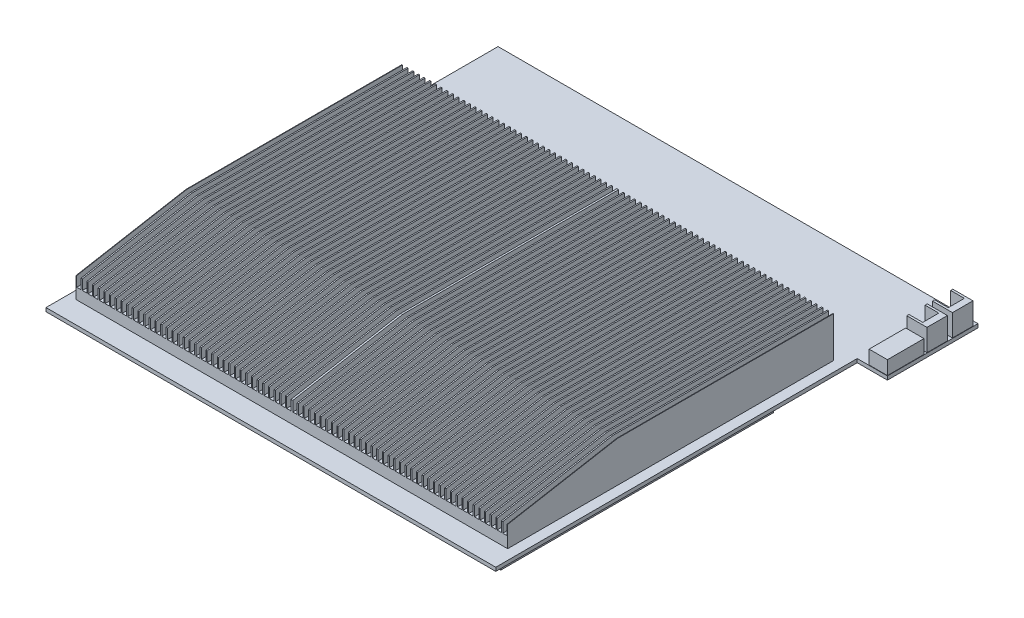
from build123d import *

# Parameters (mm, degrees)
BOSS_EXTRUDE1_DEPTH   = 2
SKETCH2_W             = 235.75
SKETCH2_H             = 178
BOSS_EXTRUDE2_DEPTH   = 22.2
CUT_EXTRUDE1_DEPTH    = 235.75
SKETCH5_W             = 27.3
SKETCH5_H             = 30.25
BOSS_EXTRUDE4_DEPTH   = 12.75
SKETCH6_W             = 2.4
SKETCH6_H             = 16.2
CUT_EXTRUDE2_DEPTH    = 325.747136246
SKETCH7_W             = 2.4
SKETCH7_H             = 10.810120739
CUT_EXTRUDE3_DEPTH    = 352.142086626
SKETCH8_W             = 10
SKETCH8_H             = 20
BOSS_EXTRUDE5_DEPTH   = 7.5
BOSS_EXTRUDE6_DEPTH   = 12
BOSS_EXTRUDE6_2_DEPTH = 12


with BuildPart() as part:
    # Sketch1 → Boss-Extrude1 (new body)
    with BuildSketch(Plane(origin=(0, 0, 0), x_dir=(1, 0, 0), z_dir=(0, 1, 0))):
        Polygon((0, 0), (0, 247), (262.25, 247), (262.25, 197.5), (245.75, 197.5), (245.75, 0), align=None)
    extrude(amount=BOSS_EXTRUDE1_DEPTH)

    # Sketch2 → Boss-Extrude2 (add)
    with BuildSketch(Plane(origin=(0, 2, 0), x_dir=(1, 0, 0), z_dir=(0, 1, 0))):
        with Locations((122.375, 101)):
            Rectangle(SKETCH2_W, SKETCH2_H)
    extrude(amount=BOSS_EXTRUDE2_DEPTH)

    # Sketch3 → Cut-Extrude1 (cut)
    with BuildSketch(Plane(origin=(240.25, 0, 0), x_dir=(0, 0, -1), z_dir=(1, 0, 0))):
        Polygon((12, 13.5), (72, 24.2), (12, 24.2), align=None)
    extrude(amount=-CUT_EXTRUDE1_DEPTH, mode=Mode.SUBTRACT)

    # Sketch5 → Boss-Extrude4 (add)
    with BuildSketch(Plane.XZ):
        Polygon((7.969075183, -163.75), (7.969075183, -14.75), (233.75849879, -14.75), (233.75849879, -163.75), (174.25849879, -163.75), (174.25849879, -196.5), (67.469075183, -196.5), (67.469075183, -163.75), align=None)
        with Locations((136.200813534, -226.375)):
            Rectangle(SKETCH5_W, SKETCH5_H)
    extrude(amount=BOSS_EXTRUDE4_DEPTH)

    # Sketch6 → Cut-Extrude2 (cut, through all)
    with BuildSketch(Plane(origin=(0, 0, -190), x_dir=(-1, 0, 0), z_dir=(0, 0, -1))):
        with Locations((-124.075, 16.1)):
            Rectangle(SKETCH6_W, SKETCH6_H)
        with Locations((-120.675, 16.1)):
            Rectangle(SKETCH6_W, SKETCH6_H)
        with Locations((-127.175, 16.1)):
            Rectangle(SKETCH6_W, SKETCH6_H)
        with Locations((-130.275, 16.1)):
            Rectangle(SKETCH6_W, SKETCH6_H)
        with Locations((-133.375, 16.1)):
            Rectangle(SKETCH6_W, SKETCH6_H)
        with Locations((-136.475, 16.1)):
            Rectangle(SKETCH6_W, SKETCH6_H)
        with Locations((-139.575, 16.1)):
            Rectangle(SKETCH6_W, SKETCH6_H)
        with Locations((-142.675, 16.1)):
            Rectangle(SKETCH6_W, SKETCH6_H)
        with Locations((-145.775, 16.1)):
            Rectangle(SKETCH6_W, SKETCH6_H)
        with Locations((-148.875, 16.1)):
            Rectangle(SKETCH6_W, SKETCH6_H)
        with Locations((-151.975, 16.1)):
            Rectangle(SKETCH6_W, SKETCH6_H)
        with Locations((-155.075, 16.1)):
            Rectangle(SKETCH6_W, SKETCH6_H)
        with Locations((-158.175, 16.1)):
            Rectangle(SKETCH6_W, SKETCH6_H)
        with Locations((-161.275, 16.1)):
            Rectangle(SKETCH6_W, SKETCH6_H)
        with Locations((-164.375, 16.1)):
            Rectangle(SKETCH6_W, SKETCH6_H)
        with Locations((-167.475, 16.1)):
            Rectangle(SKETCH6_W, SKETCH6_H)
        with Locations((-170.575, 16.1)):
            Rectangle(SKETCH6_W, SKETCH6_H)
        with Locations((-173.675, 16.1)):
            Rectangle(SKETCH6_W, SKETCH6_H)
        with Locations((-176.775, 16.1)):
            Rectangle(SKETCH6_W, SKETCH6_H)
        with Locations((-179.875, 16.1)):
            Rectangle(SKETCH6_W, SKETCH6_H)
        with Locations((-182.975, 16.1)):
            Rectangle(SKETCH6_W, SKETCH6_H)
        with Locations((-186.075, 16.1)):
            Rectangle(SKETCH6_W, SKETCH6_H)
        with Locations((-189.175, 16.1)):
            Rectangle(SKETCH6_W, SKETCH6_H)
        with Locations((-192.275, 16.1)):
            Rectangle(SKETCH6_W, SKETCH6_H)
        with Locations((-195.375, 16.1)):
            Rectangle(SKETCH6_W, SKETCH6_H)
        with Locations((-198.475, 16.1)):
            Rectangle(SKETCH6_W, SKETCH6_H)
        with Locations((-201.575, 16.1)):
            Rectangle(SKETCH6_W, SKETCH6_H)
        with Locations((-204.675, 16.1)):
            Rectangle(SKETCH6_W, SKETCH6_H)
        with Locations((-207.775, 16.1)):
            Rectangle(SKETCH6_W, SKETCH6_H)
        with Locations((-210.875, 16.1)):
            Rectangle(SKETCH6_W, SKETCH6_H)
        with Locations((-213.975, 16.1)):
            Rectangle(SKETCH6_W, SKETCH6_H)
        with Locations((-217.075, 16.1)):
            Rectangle(SKETCH6_W, SKETCH6_H)
        with Locations((-220.175, 16.1)):
            Rectangle(SKETCH6_W, SKETCH6_H)
        with Locations((-223.275, 16.1)):
            Rectangle(SKETCH6_W, SKETCH6_H)
        with Locations((-226.375, 16.1)):
            Rectangle(SKETCH6_W, SKETCH6_H)
        with Locations((-229.475, 16.1)):
            Rectangle(SKETCH6_W, SKETCH6_H)
        with Locations((-232.575, 16.1)):
            Rectangle(SKETCH6_W, SKETCH6_H)
        with Locations((-235.675, 16.1)):
            Rectangle(SKETCH6_W, SKETCH6_H)
        with Locations((-238.775, 16.1)):
            Rectangle(SKETCH6_W, SKETCH6_H)
        with Locations((-117.575, 16.1)):
            Rectangle(SKETCH6_W, SKETCH6_H)
        with Locations((-114.475, 16.1)):
            Rectangle(SKETCH6_W, SKETCH6_H)
        with Locations((-111.375, 16.1)):
            Rectangle(SKETCH6_W, SKETCH6_H)
        with Locations((-108.275, 16.1)):
            Rectangle(SKETCH6_W, SKETCH6_H)
        with Locations((-105.175, 16.1)):
            Rectangle(SKETCH6_W, SKETCH6_H)
        with Locations((-102.075, 16.1)):
            Rectangle(SKETCH6_W, SKETCH6_H)
        with Locations((-98.975, 16.1)):
            Rectangle(SKETCH6_W, SKETCH6_H)
        with Locations((-95.875, 16.1)):
            Rectangle(SKETCH6_W, SKETCH6_H)
        with Locations((-92.775, 16.1)):
            Rectangle(SKETCH6_W, SKETCH6_H)
        with Locations((-89.675, 16.1)):
            Rectangle(SKETCH6_W, SKETCH6_H)
        with Locations((-86.575, 16.1)):
            Rectangle(SKETCH6_W, SKETCH6_H)
        with Locations((-83.475, 16.1)):
            Rectangle(SKETCH6_W, SKETCH6_H)
        with Locations((-80.375, 16.1)):
            Rectangle(SKETCH6_W, SKETCH6_H)
        with Locations((-77.275, 16.1)):
            Rectangle(SKETCH6_W, SKETCH6_H)
        with Locations((-74.175, 16.1)):
            Rectangle(SKETCH6_W, SKETCH6_H)
        with Locations((-71.075, 16.1)):
            Rectangle(SKETCH6_W, SKETCH6_H)
        with Locations((-67.975, 16.1)):
            Rectangle(SKETCH6_W, SKETCH6_H)
        with Locations((-64.875, 16.1)):
            Rectangle(SKETCH6_W, SKETCH6_H)
        with Locations((-61.775, 16.1)):
            Rectangle(SKETCH6_W, SKETCH6_H)
        with Locations((-58.675, 16.1)):
            Rectangle(SKETCH6_W, SKETCH6_H)
        with Locations((-55.575, 16.1)):
            Rectangle(SKETCH6_W, SKETCH6_H)
        with Locations((-52.475, 16.1)):
            Rectangle(SKETCH6_W, SKETCH6_H)
        with Locations((-49.375, 16.1)):
            Rectangle(SKETCH6_W, SKETCH6_H)
        with Locations((-46.275, 16.1)):
            Rectangle(SKETCH6_W, SKETCH6_H)
        with Locations((-43.175, 16.1)):
            Rectangle(SKETCH6_W, SKETCH6_H)
        with Locations((-40.075, 16.1)):
            Rectangle(SKETCH6_W, SKETCH6_H)
        with Locations((-36.975, 16.1)):
            Rectangle(SKETCH6_W, SKETCH6_H)
        with Locations((-33.875, 16.1)):
            Rectangle(SKETCH6_W, SKETCH6_H)
        with Locations((-30.775, 16.1)):
            Rectangle(SKETCH6_W, SKETCH6_H)
        with Locations((-27.675, 16.1)):
            Rectangle(SKETCH6_W, SKETCH6_H)
        with Locations((-24.575, 16.1)):
            Rectangle(SKETCH6_W, SKETCH6_H)
        with Locations((-21.475, 16.1)):
            Rectangle(SKETCH6_W, SKETCH6_H)
        with Locations((-18.375, 16.1)):
            Rectangle(SKETCH6_W, SKETCH6_H)
        with Locations((-15.275, 16.1)):
            Rectangle(SKETCH6_W, SKETCH6_H)
        with Locations((-12.175, 16.1)):
            Rectangle(SKETCH6_W, SKETCH6_H)
        with Locations((-9.075, 16.1)):
            Rectangle(SKETCH6_W, SKETCH6_H)
        with Locations((-5.975, 16.1)):
            Rectangle(SKETCH6_W, SKETCH6_H)
    extrude(amount=-CUT_EXTRUDE2_DEPTH, mode=Mode.SUBTRACT)

    # Sketch7 → Cut-Extrude3 (cut, through all)
    with BuildSketch(Plane.XY.offset(-14.75)):
        with Locations((118.663786987, -7.34493963)):
            Rectangle(SKETCH7_W, SKETCH7_H)
        with Locations((123.063786987, -7.34493963)):
            Rectangle(SKETCH7_W, SKETCH7_H)
        with Locations((126.163786987, -7.34493963)):
            Rectangle(SKETCH7_W, SKETCH7_H)
        with Locations((129.263786987, -7.34493963)):
            Rectangle(SKETCH7_W, SKETCH7_H)
        with Locations((132.363786987, -7.34493963)):
            Rectangle(SKETCH7_W, SKETCH7_H)
        with Locations((135.463786987, -7.34493963)):
            Rectangle(SKETCH7_W, SKETCH7_H)
        with Locations((138.563786987, -7.34493963)):
            Rectangle(SKETCH7_W, SKETCH7_H)
        with Locations((141.663786987, -7.34493963)):
            Rectangle(SKETCH7_W, SKETCH7_H)
        with Locations((144.763786987, -7.34493963)):
            Rectangle(SKETCH7_W, SKETCH7_H)
        with Locations((147.863786987, -7.34493963)):
            Rectangle(SKETCH7_W, SKETCH7_H)
        with Locations((150.963786987, -7.34493963)):
            Rectangle(SKETCH7_W, SKETCH7_H)
        with Locations((154.063786987, -7.34493963)):
            Rectangle(SKETCH7_W, SKETCH7_H)
        with Locations((157.163786987, -7.34493963)):
            Rectangle(SKETCH7_W, SKETCH7_H)
        with Locations((160.263786987, -7.34493963)):
            Rectangle(SKETCH7_W, SKETCH7_H)
        with Locations((163.363786987, -7.34493963)):
            Rectangle(SKETCH7_W, SKETCH7_H)
        with Locations((166.463786987, -7.34493963)):
            Rectangle(SKETCH7_W, SKETCH7_H)
        with Locations((169.563786987, -7.34493963)):
            Rectangle(SKETCH7_W, SKETCH7_H)
        with Locations((172.663786987, -7.34493963)):
            Rectangle(SKETCH7_W, SKETCH7_H)
        with Locations((175.763786987, -7.34493963)):
            Rectangle(SKETCH7_W, SKETCH7_H)
        with Locations((178.863786987, -7.34493963)):
            Rectangle(SKETCH7_W, SKETCH7_H)
        with Locations((181.963786987, -7.34493963)):
            Rectangle(SKETCH7_W, SKETCH7_H)
        with Locations((185.063786987, -7.34493963)):
            Rectangle(SKETCH7_W, SKETCH7_H)
        with Locations((188.163786987, -7.34493963)):
            Rectangle(SKETCH7_W, SKETCH7_H)
        with Locations((191.263786987, -7.34493963)):
            Rectangle(SKETCH7_W, SKETCH7_H)
        with Locations((194.363786987, -7.34493963)):
            Rectangle(SKETCH7_W, SKETCH7_H)
        with Locations((197.463786987, -7.34493963)):
            Rectangle(SKETCH7_W, SKETCH7_H)
        with Locations((200.563786987, -7.34493963)):
            Rectangle(SKETCH7_W, SKETCH7_H)
        with Locations((203.663786987, -7.34493963)):
            Rectangle(SKETCH7_W, SKETCH7_H)
        with Locations((206.763786987, -7.34493963)):
            Rectangle(SKETCH7_W, SKETCH7_H)
        with Locations((209.863786987, -7.34493963)):
            Rectangle(SKETCH7_W, SKETCH7_H)
        with Locations((212.963786987, -7.34493963)):
            Rectangle(SKETCH7_W, SKETCH7_H)
        with Locations((216.063786987, -7.34493963)):
            Rectangle(SKETCH7_W, SKETCH7_H)
        with Locations((219.163786987, -7.34493963)):
            Rectangle(SKETCH7_W, SKETCH7_H)
        with Locations((222.263786987, -7.34493963)):
            Rectangle(SKETCH7_W, SKETCH7_H)
        with Locations((225.363786987, -7.34493963)):
            Rectangle(SKETCH7_W, SKETCH7_H)
        with Locations((228.463786987, -7.34493963)):
            Rectangle(SKETCH7_W, SKETCH7_H)
        with Locations((231.563786987, -7.34493963)):
            Rectangle(SKETCH7_W, SKETCH7_H)
        with Locations((115.563786987, -7.34493963)):
            Rectangle(SKETCH7_W, SKETCH7_H)
        with Locations((112.463786987, -7.34493963)):
            Rectangle(SKETCH7_W, SKETCH7_H)
        with Locations((109.363786987, -7.34493963)):
            Rectangle(SKETCH7_W, SKETCH7_H)
        with Locations((106.263786987, -7.34493963)):
            Rectangle(SKETCH7_W, SKETCH7_H)
        with Locations((103.163786987, -7.34493963)):
            Rectangle(SKETCH7_W, SKETCH7_H)
        with Locations((100.063786987, -7.34493963)):
            Rectangle(SKETCH7_W, SKETCH7_H)
        with Locations((96.963786987, -7.34493963)):
            Rectangle(SKETCH7_W, SKETCH7_H)
        with Locations((93.863786987, -7.34493963)):
            Rectangle(SKETCH7_W, SKETCH7_H)
        with Locations((90.763786987, -7.34493963)):
            Rectangle(SKETCH7_W, SKETCH7_H)
        with Locations((87.663786987, -7.34493963)):
            Rectangle(SKETCH7_W, SKETCH7_H)
        with Locations((84.563786987, -7.34493963)):
            Rectangle(SKETCH7_W, SKETCH7_H)
        with Locations((81.463786987, -7.34493963)):
            Rectangle(SKETCH7_W, SKETCH7_H)
        with Locations((78.363786987, -7.34493963)):
            Rectangle(SKETCH7_W, SKETCH7_H)
        with Locations((75.263786987, -7.34493963)):
            Rectangle(SKETCH7_W, SKETCH7_H)
        with Locations((72.163786987, -7.34493963)):
            Rectangle(SKETCH7_W, SKETCH7_H)
        with Locations((69.063786987, -7.34493963)):
            Rectangle(SKETCH7_W, SKETCH7_H)
        with Locations((65.963786987, -7.34493963)):
            Rectangle(SKETCH7_W, SKETCH7_H)
        with Locations((62.863786987, -7.34493963)):
            Rectangle(SKETCH7_W, SKETCH7_H)
        with Locations((59.763786987, -7.34493963)):
            Rectangle(SKETCH7_W, SKETCH7_H)
        with Locations((56.663786987, -7.34493963)):
            Rectangle(SKETCH7_W, SKETCH7_H)
        with Locations((53.563786987, -7.34493963)):
            Rectangle(SKETCH7_W, SKETCH7_H)
        with Locations((50.463786987, -7.34493963)):
            Rectangle(SKETCH7_W, SKETCH7_H)
        with Locations((47.363786987, -7.34493963)):
            Rectangle(SKETCH7_W, SKETCH7_H)
        with Locations((44.263786987, -7.34493963)):
            Rectangle(SKETCH7_W, SKETCH7_H)
        with Locations((41.163786987, -7.34493963)):
            Rectangle(SKETCH7_W, SKETCH7_H)
        with Locations((38.063786987, -7.34493963)):
            Rectangle(SKETCH7_W, SKETCH7_H)
        with Locations((34.963786987, -7.34493963)):
            Rectangle(SKETCH7_W, SKETCH7_H)
        with Locations((31.863786987, -7.34493963)):
            Rectangle(SKETCH7_W, SKETCH7_H)
        with Locations((28.763786987, -7.34493963)):
            Rectangle(SKETCH7_W, SKETCH7_H)
        with Locations((25.663786987, -7.34493963)):
            Rectangle(SKETCH7_W, SKETCH7_H)
        with Locations((22.563786987, -7.34493963)):
            Rectangle(SKETCH7_W, SKETCH7_H)
        with Locations((19.463786987, -7.34493963)):
            Rectangle(SKETCH7_W, SKETCH7_H)
        with Locations((16.363786987, -7.34493963)):
            Rectangle(SKETCH7_W, SKETCH7_H)
        with Locations((13.263786987, -7.34493963)):
            Rectangle(SKETCH7_W, SKETCH7_H)
        with Locations((10.163786987, -7.34493963)):
            Rectangle(SKETCH7_W, SKETCH7_H)
    extrude(amount=-CUT_EXTRUDE3_DEPTH, mode=Mode.SUBTRACT)


with BuildPart() as body_2:
    # Sketch8 → Boss-Extrude5 (new body)
    with BuildSketch(Plane(origin=(0, 2.2, 0), x_dir=(1, 0, 0), z_dir=(0, 1, 0))):
        with Locations((257.25, 207.5)):
            Rectangle(SKETCH8_W, SKETCH8_H)
    extrude(amount=BOSS_EXTRUDE5_DEPTH)


with BuildPart() as body_3:
    # Sketch9 → Boss-Extrude6 (new body)
    with BuildSketch(Plane(origin=(0, 2.2, 0), x_dir=(1, 0, 0), z_dir=(0, 1, 0))):
        Polygon((251.25, 233.05), (262.25, 233.05), (262.25, 244.25), (251.25, 244.25), (251.25, 243.05), (258.75, 243.05), (258.75, 234.25), (251.25, 234.25), align=None)
    extrude(amount=BOSS_EXTRUDE6_DEPTH)


with BuildPart() as body_4:
    # Sketch9 → Boss-Extrude6 2 (new body)
    with BuildSketch(Plane(origin=(0, 2.2, 0), x_dir=(1, 0, 0), z_dir=(0, 1, 0))):
        Polygon((251.25, 219.1), (262.25, 219.1), (262.25, 230.3), (251.25, 230.3), (251.25, 229.1), (258.75, 229.1), (258.75, 220.3), (251.25, 220.3), align=None)
    extrude(amount=BOSS_EXTRUDE6_2_DEPTH)


solid = Compound([part.part, body_2.part, body_3.part, body_4.part])
